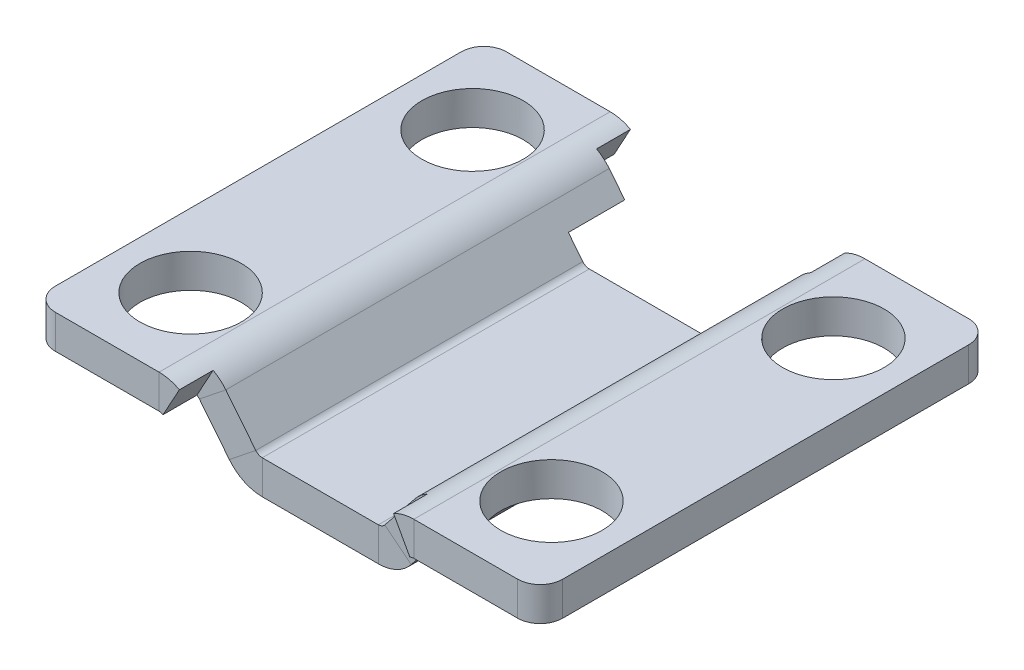
from build123d import *

# Parameters (mm, degrees)
BRIDA_BASE2_DEPTH       = 20
CORTAR_EXTRUIR1_START   = -20
CORTAR_EXTRUIR1_DEPTH   = 8
CORTAR_EXTRUIR1_START_2 = 17
CORTAR_EXTRUIR1_2_DEPTH = 3
CORTAR_EXTRUIR1_3_DEPTH = 3
CORTAR_EXTRUIR2_REACH   = 33.149
CROQUIS13_R             = 4.5
REDONDEO1_R             = 2


# Read off the part's stored shape, not the designer's step: Cortar-Extruir1
# Sheet-metal steps are written as plain solids
with BuildPart() as part:
    # Croquis9 → Brida base2 (new, symmetric)
    with BuildSketch(Plane.XY):
        with BuildLine():
            Line((-22.5, 0), (-11.295902805, 0))
            ThreePointArc((-11.295902805, 0), (-9.677249795, -0.368790327), (-8.378108412, -1.402364485))
            Line((-8.378108412, -1.402364485), (-5.721159702, -4.723550372))
            ThreePointArc((-5.721159702, -4.723550372), (-5.465058556, -4.927299964), (-5.145971737, -5))
            Line((-5.145971737, -5), (5.145971737, -5))
            ThreePointArc((5.145971737, -5), (5.465058556, -4.927299964), (5.721159702, -4.723550372))
            Line((5.721159702, -4.723550372), (8.378108412, -1.402364485))
            ThreePointArc((8.378108412, -1.402364485), (9.677249795, -0.368790327), (11.295902805, 0))
            Line((11.295902805, 0), (22.5, 0))
            Line((22.5, 0), (22.5, -3))
            Line((22.5, -3), (11.295902805, -3))
            ThreePointArc((11.295902805, -3), (10.976815986, -3.072700036), (10.72071484, -3.276449628))
            Line((10.72071484, -3.276449628), (8.063766131, -6.597635515))
            ThreePointArc((8.063766131, -6.597635515), (6.764624748, -7.631209673), (5.145971737, -8))
            Line((5.145971737, -8), (-5.145971737, -8))
            ThreePointArc((-5.145971737, -8), (-6.764624748, -7.631209673), (-8.063766131, -6.597635515))
            Line((-8.063766131, -6.597635515), (-10.72071484, -3.276449628))
            ThreePointArc((-10.72071484, -3.276449628), (-10.976815986, -3.072700036), (-11.295902805, -3))
            Line((-11.295902805, -3), (-22.5, -3))
            Line((-22.5, -3), (-22.5, 0))
        make_face()
    extrude(amount=BRIDA_BASE2_DEPTH, both=True)

    # Cortar-Extruir1 outline → Cortar-Extruir1 (cut)
    with BuildSketch(Plane.XY.offset(CORTAR_EXTRUIR1_START)):
        with BuildLine():
            Line((8.063766131, -6.597635515), (9.342606428, -4.999085143))
            Line((9.342606428, -4.999085143), (7, -3.125))
            Line((7, -3.125), (5.721159702, -4.723550372))
            ThreePointArc((5.721159702, -4.723550372), (5.465058556, -4.927299964), (5.145971737, -5))
            Line((5.145971737, -5), (-5.145971737, -5))
            ThreePointArc((-5.145971737, -5), (-5.465058556, -4.927299964), (-5.721159702, -4.723550372))
            Line((-5.721159702, -4.723550372), (-7, -3.125))
            Line((-7, -3.125), (-9.342606428, -4.999085143))
            Line((-9.342606428, -4.999085143), (-8.063766131, -6.597635515))
            ThreePointArc((-8.063766131, -6.597635515), (-6.764624748, -7.631209673), (-5.145971737, -8))
            Line((-5.145971737, -8), (5.145971737, -8))
            ThreePointArc((5.145971737, -8), (6.764624748, -7.631209673), (8.063766131, -6.597635515))
        make_face()
    extrude(amount=CORTAR_EXTRUIR1_DEPTH, mode=Mode.SUBTRACT)

    # Cortar-Extruir1 2 outline → Cortar-Extruir1 2 (cut)
    with BuildSketch(Plane.XY.offset(CORTAR_EXTRUIR1_START_2)):
        with BuildLine():
            Line((8.063766131, -6.597635515), (10.72071484, -3.276449628))
            ThreePointArc((10.72071484, -3.276449628), (10.82209851, -3.172606162), (10.941874542, -3.090656079))
            Line((10.941874542, -3.090656079), (9.5, -0.459877144))
            ThreePointArc((9.5, -0.459877144), (8.892404123, -0.8755908), (8.378108412, -1.402364485))
            Line((8.378108412, -1.402364485), (5.721159702, -4.723550372))
            ThreePointArc((5.721159702, -4.723550372), (5.465058556, -4.927299964), (5.145971737, -5))
            Line((5.145971737, -5), (-5.145971737, -5))
            ThreePointArc((-5.145971737, -5), (-5.465058556, -4.927299964), (-5.721159702, -4.723550372))
            Line((-5.721159702, -4.723550372), (-8.378108412, -1.402364485))
            ThreePointArc((-8.378108412, -1.402364485), (-8.892404123, -0.8755908), (-9.5, -0.459877144))
            Line((-9.5, -0.459877144), (-10.941874542, -3.090656079))
            ThreePointArc((-10.941874542, -3.090656079), (-10.82209851, -3.172606162), (-10.72071484, -3.276449628))
            Line((-10.72071484, -3.276449628), (-8.063766131, -6.597635515))
            ThreePointArc((-8.063766131, -6.597635515), (-6.764624748, -7.631209673), (-5.145971737, -8))
            Line((-5.145971737, -8), (5.145971737, -8))
            ThreePointArc((5.145971737, -8), (6.764624748, -7.631209673), (8.063766131, -6.597635515))
        make_face()
    extrude(amount=CORTAR_EXTRUIR1_2_DEPTH, mode=Mode.SUBTRACT)

    # Cortar-Extruir1 3 outline → Cortar-Extruir1 3 (cut)
    with BuildSketch(Plane.XY.offset(CORTAR_EXTRUIR1_START)):
        with BuildLine():
            Line((7, -3.125), (9.342606428, -4.999085143))
            Line((9.342606428, -4.999085143), (10.72071484, -3.276449628))
            ThreePointArc((10.72071484, -3.276449628), (10.82209851, -3.172606162), (10.941874542, -3.090656079))
            Line((10.941874542, -3.090656079), (9.5, -0.459877144))
            ThreePointArc((9.5, -0.459877144), (8.892404123, -0.8755908), (8.378108412, -1.402364485))
            Line((8.378108412, -1.402364485), (7, -3.125))
        make_face()
        with BuildLine():
            Line((-10.72071484, -3.276449628), (-9.342606428, -4.999085143))
            Line((-9.342606428, -4.999085143), (-7, -3.125))
            Line((-7, -3.125), (-8.378108412, -1.402364485))
            ThreePointArc((-8.378108412, -1.402364485), (-8.892404123, -0.8755908), (-9.5, -0.459877144))
            Line((-9.5, -0.459877144), (-10.941874542, -3.090656079))
            ThreePointArc((-10.941874542, -3.090656079), (-10.82209851, -3.172606162), (-10.72071484, -3.276449628))
        make_face()
    extrude(amount=CORTAR_EXTRUIR1_3_DEPTH, mode=Mode.SUBTRACT)

    # Croquis13 → Cortar-Extruir2 (cut, up to next)
    with BuildSketch(Plane(origin=(0, 0, 0), x_dir=(1, 0, 0), z_dir=(0, 1, 0)), mode=Mode.PRIVATE) as cortar_extruir2_sk1:
        with Locations(Location((-16, 12.5, 0), (0, 0, 270))):
            Circle(CROQUIS13_R)
    cortar_extruir2_tool1 = extrude(cortar_extruir2_sk1.sketch, amount=-CORTAR_EXTRUIR2_REACH, mode=Mode.PRIVATE) & part.part
    # Croquis13 → Cortar-Extruir2 (cut, up to next)
    with BuildSketch(Plane(origin=(0, 0, 0), x_dir=(1, 0, 0), z_dir=(0, 1, 0)), mode=Mode.PRIVATE) as cortar_extruir2_sk2:
        with Locations(Location((16, 12.5, 0), (0, 0, 270))):
            Circle(CROQUIS13_R)
    cortar_extruir2_tool2 = extrude(cortar_extruir2_sk2.sketch, amount=-CORTAR_EXTRUIR2_REACH, mode=Mode.PRIVATE) & part.part
    # Croquis13 → Cortar-Extruir2 (cut, up to next)
    with BuildSketch(Plane(origin=(0, 0, 0), x_dir=(1, 0, 0), z_dir=(0, 1, 0)), mode=Mode.PRIVATE) as cortar_extruir2_sk3:
        with Locations(Location((16, -12.5, 0), (0, 0, 270))):
            Circle(CROQUIS13_R)
    cortar_extruir2_tool3 = extrude(cortar_extruir2_sk3.sketch, amount=-CORTAR_EXTRUIR2_REACH, mode=Mode.PRIVATE) & part.part
    # Croquis13 → Cortar-Extruir2 (cut, up to next)
    with BuildSketch(Plane(origin=(0, 0, 0), x_dir=(1, 0, 0), z_dir=(0, 1, 0)), mode=Mode.PRIVATE) as cortar_extruir2_sk4:
        with Locations(Location((-16, -12.5, 0), (0, 0, 270))):
            Circle(CROQUIS13_R)
    cortar_extruir2_tool4 = extrude(cortar_extruir2_sk4.sketch, amount=-CORTAR_EXTRUIR2_REACH, mode=Mode.PRIVATE) & part.part
    add(cortar_extruir2_tool1.solids().sort_by_distance((-16, 0, -12.5))[0], mode=Mode.SUBTRACT)
    add(cortar_extruir2_tool2.solids().sort_by_distance((16, 0, -12.5))[0], mode=Mode.SUBTRACT)
    add(cortar_extruir2_tool3.solids().sort_by_distance((16, 0, 12.5))[0], mode=Mode.SUBTRACT)
    add(cortar_extruir2_tool4.solids().sort_by_distance((-16, 0, 12.5))[0], mode=Mode.SUBTRACT)

    # Redondeo1
    redondeo1_edges = [part.edges().sort_by_distance(p)[0] for p in [
        (22.5, -1.5, -20),
        (-22.5, -1.5, -20),
        (22.5, -1.5, 20),
        (-22.5, -1.5, 20),
    ]]
    fillet(redondeo1_edges, radius=REDONDEO1_R)


solid = part.part
